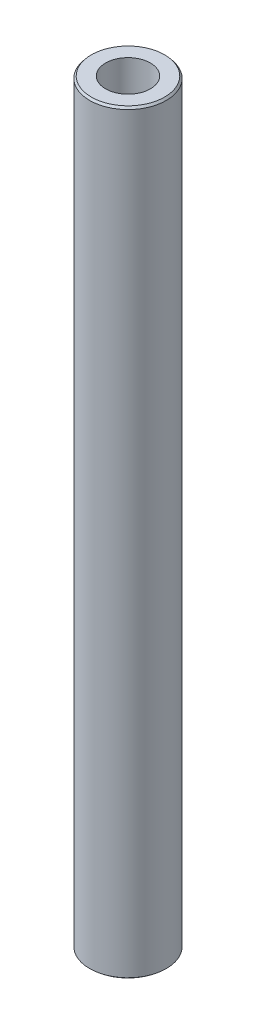
from build123d import *
from OCP.BRepFilletAPI import BRepFilletAPI_MakeChamfer

# Parameters (mm, degrees)
SKETCH1_R           = 7.5
BOSS_EXTRUDE1_DEPTH = 147.908068498
SKETCH2_R           = 4.390228695
CUT_EXTRUDE1_DEPTH  = 149.287884626
CHAMFER1_SIZE       = 0.40914438
CHAMFER1_SIZE2      = 0.32675584


with BuildPart() as part:
    # Sketch1 → Boss-Extrude1 (new body)
    with BuildSketch(Plane(origin=(0, 0, 0), x_dir=(1, 0, 0), z_dir=(0, 1, 0))):
        Circle(SKETCH1_R)
    extrude(amount=BOSS_EXTRUDE1_DEPTH)

    # Sketch2 → Cut-Extrude1 (cut, through all)
    with BuildSketch(Plane(origin=(0, 0, 0), x_dir=(1, 0, 0), z_dir=(0, 1, 0))):
        Circle(SKETCH2_R)
    extrude(amount=CUT_EXTRUDE1_DEPTH, mode=Mode.SUBTRACT)

    # Chamfer1: one chamfer whose edges measure the first distance from different faces: ONE call of the kernel's chamfer builder (chamfer() names one face for all edges)
    chamfer1_edges_1 = [part.edges().sort_by_distance(p)[0] for p in [
        (-7.5, 147.908068498, 0),
    ]]
    chamfer1_side_1 = [part.faces().sort_by_distance(p)[0] for p in [
        (-7.5, 73.954034249, 0),
    ]]
    chamfer1_edges_2 = [part.edges().sort_by_distance(p)[0] for p in [
        (-7.5, 0, 0),
    ]]
    chamfer1_side_2 = [part.faces().sort_by_distance(p)[0] for p in [
        (-7.287867966, 0, 0),
    ]]
    chamfer1 = BRepFilletAPI_MakeChamfer(part.part.solid().wrapped)
    for e in chamfer1_edges_1:
        chamfer1.Add(CHAMFER1_SIZE, CHAMFER1_SIZE2, e.wrapped, chamfer1_side_1[0].wrapped)  # the first distance lies on this face
    for e in chamfer1_edges_2:
        chamfer1.Add(CHAMFER1_SIZE, CHAMFER1_SIZE2, e.wrapped, chamfer1_side_2[0].wrapped)  # the first distance lies on this face
    add(Compound.cast(chamfer1.Shape()), mode=Mode.REPLACE)


solid = part.part
